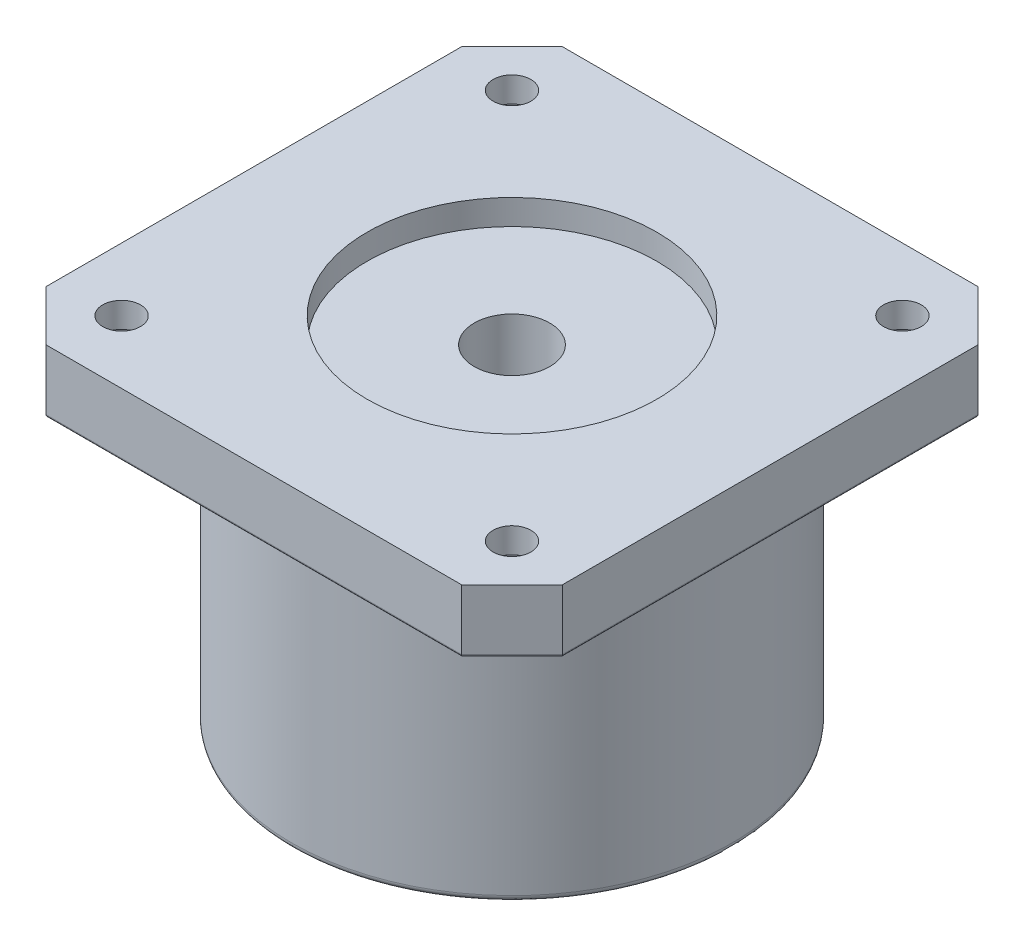
from build123d import *

# Parameters (mm, degrees)
SKETCH1_W           = 41
SKETCH1_H           = 41
BOSS_EXTRUDE1_DEPTH = 5
CUT_EXTRUDE2_DEPTH  = 5
SKETCH4_R           = 11.5
CUT_EXTRUDE3_DEPTH  = 2
SKETCH6_R           = 17.5
BOSS_EXTRUDE2_DEPTH = 23
FILLET1_R           = 0.2
FILLET2_R           = 0.5
SKETCH13_R          = 11
BOSS_EXTRUDE3_DEPTH = 2
SKETCH5_R           = 3
CUT_EXTRUDE9_DEPTH  = 66.283994976
SKETCH14_R          = 2.5
CUT_EXTRUDE10_DEPTH = 5
SKETCH15_R          = 1.355252747
CUT_EXTRUDE11_DEPTH = 5
SKETCH16_R          = 2.5
CUT_EXTRUDE12_DEPTH = 3
SKETCH17_R          = 1.5
CUT_EXTRUDE13_DEPTH = 65.389440128


with BuildPart() as part:
    # Sketch1 → Boss-Extrude1 (new body)
    with BuildSketch(Plane(origin=(0, 0, 0), x_dir=(1, 0, 0), z_dir=(0, 1, 0))):
        with Locations((20.5, 20.5)):
            Rectangle(SKETCH1_W, SKETCH1_H)
    extrude(amount=BOSS_EXTRUDE1_DEPTH)

    # Sketch2 → Cut-Extrude2 (cut)
    with BuildSketch(Plane(origin=(0, 5, 0), x_dir=(1, 0, 0), z_dir=(0, 1, 0))):
        Polygon((0, 4), (0, 0), (4, 0), align=None)
        Polygon((0, 41), (0, 37), (4, 41), align=None)
        Polygon((41, 4), (37, 0), (41, 0), align=None)
        Polygon((41, 41), (37, 41), (41, 37), align=None)
    extrude(amount=-CUT_EXTRUDE2_DEPTH, mode=Mode.SUBTRACT)

    # Sketch4 → Cut-Extrude3 (cut)
    with BuildSketch(Plane(origin=(0, 5, 0), x_dir=(1, 0, 0), z_dir=(0, 1, 0))):
        with Locations((20.5, 20.5)):
            Circle(SKETCH4_R)
    extrude(amount=-CUT_EXTRUDE3_DEPTH, mode=Mode.SUBTRACT)

    # Sketch6 → Boss-Extrude2 (add)
    with BuildSketch(Plane.XZ):
        with Locations((20.5, -20.5)):
            Circle(SKETCH6_R)
    extrude(amount=BOSS_EXTRUDE2_DEPTH)

    # Fillet1
    fillet1_edges = [part.edges().sort_by_distance(p)[0] for p in [
        (2, 0, -39),
        (0, 0, -20.5),
        (2, 0, -2),
        (20.5, 0, -41),
        (39, 0, -39),
        (41, 0, -20.5),
        (39, 0, -2),
        (20.5, 0, 0),
    ]]
    fillet(fillet1_edges, radius=FILLET1_R)

    # Fillet2
    fillet2_edges = [part.edges().sort_by_distance(p)[0] for p in [
        (3, -23, -20.5),
    ]]
    fillet(fillet2_edges, radius=FILLET2_R)

    # Sketch13 → Boss-Extrude3 (add)
    with BuildSketch(Plane(origin=(0, -23, 0), x_dir=(-1, 0, 0), z_dir=(0, -1, 0))):
        with Locations((-20.5, 20.5)):
            Circle(SKETCH13_R)
    extrude(amount=BOSS_EXTRUDE3_DEPTH)

    # Sketch5 → Cut-Extrude9 (cut, through all)
    with BuildSketch(Plane(origin=(0, 5, 0), x_dir=(1, 0, 0), z_dir=(0, 1, 0))):
        with Locations((20.5, 20.5)):
            Circle(SKETCH5_R)
    extrude(amount=-CUT_EXTRUDE9_DEPTH, mode=Mode.SUBTRACT)

    # Sketch14 → Cut-Extrude10 (cut)
    with BuildSketch(Plane(origin=(0, -23, 0), x_dir=(-1, 0, 0), z_dir=(0, -1, 0))):
        with Locations((-20.5, 6.5)):
            Circle(SKETCH14_R)
        with Locations((-34.5, 20.5)):
            Circle(SKETCH14_R)
        with Locations((-20.5, 34.5)):
            Circle(SKETCH14_R)
        with Locations((-6.5, 20.5)):
            Circle(SKETCH14_R)
    extrude(amount=-CUT_EXTRUDE10_DEPTH, mode=Mode.SUBTRACT)

    # Sketch15 → Cut-Extrude11 (cut)
    with BuildSketch(Plane(origin=(0, -23, 0), x_dir=(-1, 0, 0), z_dir=(0, -1, 0))):
        with Locations((-30.399494937, 10.600505063)):
            Circle(SKETCH15_R)
        with Locations((-30.399494937, 30.399494937)):
            Circle(SKETCH15_R)
        with Locations((-10.600505063, 30.399494937)):
            Circle(SKETCH15_R)
        with Locations((-10.600505063, 10.600505063)):
            Circle(SKETCH15_R)
    extrude(amount=-CUT_EXTRUDE11_DEPTH, mode=Mode.SUBTRACT)

    # Sketch16 → Cut-Extrude12 (cut)
    with BuildSketch(Plane(origin=(0, 0, 0), x_dir=(-1, 0, 0), z_dir=(0, -1, 0))):
        with Locations((-5, 5)):
            Circle(SKETCH16_R)
        with Locations((-36, 5)):
            Circle(SKETCH16_R)
        with Locations((-5, 36)):
            Circle(SKETCH16_R)
        with Locations((-36, 36)):
            Circle(SKETCH16_R)
    extrude(amount=-CUT_EXTRUDE12_DEPTH, mode=Mode.SUBTRACT)

    # Sketch17 → Cut-Extrude13 (cut, through all)
    with BuildSketch(Plane(origin=(0, 3, 0), x_dir=(-1, 0, 0), z_dir=(0, -1, 0))):
        with Locations((-5, 5)):
            Circle(SKETCH17_R)
        with Locations((-36, 5)):
            Circle(SKETCH17_R)
        with Locations((-5, 36)):
            Circle(SKETCH17_R)
        with Locations((-36, 36)):
            Circle(SKETCH17_R)
    extrude(amount=-CUT_EXTRUDE13_DEPTH, mode=Mode.SUBTRACT)


solid = part.part
